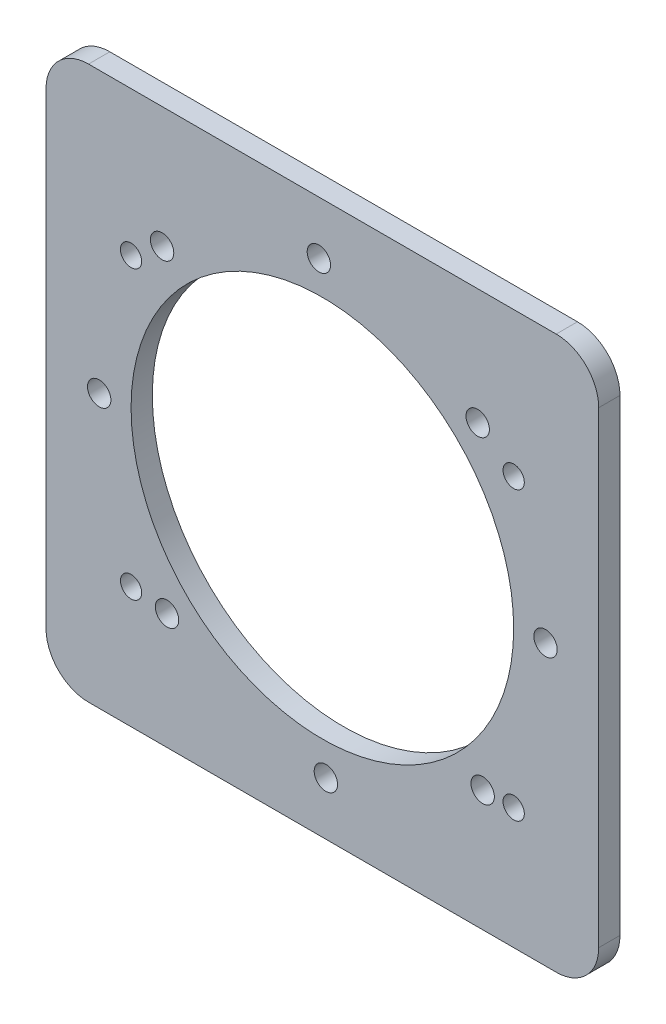
from build123d import *

# Parameters (mm, degrees)
SKETCH_1_W          = 130
SKETCH_1_H          = 130
EXTRUDE_1_DEPTH     = 5
CUT_EXTRUDE_2_REACH = 94.06
SKETCH_5_R          = 45
FILLET_1_R          = 10
CUT_EXTRUDE_3_DEPTH = 10
SKETCH_7_R          = 2.5
CUT_EXTRUDE_4_DEPTH = 93.059763198


with BuildPart() as part:
    # 草图1 → 凸台-拉伸1 (new body)
    with BuildSketch(Plane.XY):
        Rectangle(SKETCH_1_W, SKETCH_1_H)
    extrude(amount=EXTRUDE_1_DEPTH)

    # 草图5 → 切除-拉伸2 (cut, up to next)
    with BuildSketch(Plane(origin=(0, 0, 0), x_dir=(-1, 0, 0), z_dir=(0, 0, -1)), mode=Mode.PRIVATE) as cut_extrude_2_sk1:
        Circle(SKETCH_5_R)
    cut_extrude_2_tool1 = extrude(cut_extrude_2_sk1.sketch, amount=-CUT_EXTRUDE_2_REACH, mode=Mode.PRIVATE) & part.part
    add(cut_extrude_2_tool1.solids().sort_by_distance((0, 0, 0))[0], mode=Mode.SUBTRACT)

    # 圆角1
    fillet_1_edges = [part.edges().sort_by_distance(p)[0] for p in [
        (65, 65, 2.5),
        (65, -65, 2.5),
        (-65, -65, 2.5),
        (-65, 65, 2.5),
    ]]
    fillet(fillet_1_edges, radius=FILLET_1_R)

    # 草图6 → 切除-拉伸3 (cut)
    with BuildSketch(Plane(origin=(0, 0, 0), x_dir=(-1, 0, 0), z_dir=(0, 0, -1))):
        with BuildLine():
            ThreePointArc((39.675797976, 38.449883679), (35.787189387, 38.510902038), (35.726171029, 34.622293449))
            ThreePointArc((35.726171029, 34.622293449), (39.614779618, 34.56127509), (39.675797976, 38.449883679))
        make_face()
        with BuildLine():
            ThreePointArc((54.468351255, 1.090089298), (50.579742665, 1.151107656), (50.518724307, -2.737500933))
            ThreePointArc((50.518724307, -2.737500933), (54.407332896, -2.798519291), (54.468351255, 1.090089298))
        make_face()
        with BuildLine():
            ThreePointArc((38.510902038, -35.787189387), (34.622293449, -35.726171029), (34.56127509, -39.614779618))
            ThreePointArc((34.56127509, -39.614779618), (38.449883679, -39.675797976), (38.510902038, -35.787189387))
        make_face()
        with BuildLine():
            ThreePointArc((1.151107656, -50.579742665), (-2.737500933, -50.518724307), (-2.798519291, -54.407332896))
            ThreePointArc((-2.798519291, -54.407332896), (1.090089298, -54.468351255), (1.151107656, -50.579742665))
        make_face()
        with BuildLine():
            ThreePointArc((-35.726171029, -34.622293449), (-39.614779618, -34.56127509), (-39.675797976, -38.449883679))
            ThreePointArc((-39.675797976, -38.449883679), (-35.787189387, -38.510902038), (-35.726171029, -34.622293449))
        make_face()
        with BuildLine():
            ThreePointArc((-50.518724307, 2.737500933), (-54.407332896, 2.798519291), (-54.468351255, -1.090089298))
            ThreePointArc((-54.468351255, -1.090089298), (-50.579742665, -1.151107656), (-50.518724307, 2.737500933))
        make_face()
        with BuildLine():
            ThreePointArc((-34.56127509, 39.614779618), (-38.449883679, 39.675797976), (-38.510902038, 35.787189387))
            ThreePointArc((-38.510902038, 35.787189387), (-34.622293449, 35.726171029), (-34.56127509, 39.614779618))
        make_face()
        with BuildLine():
            ThreePointArc((2.798519291, 54.407332896), (-1.090089298, 54.468351255), (-1.151107656, 50.579742665))
            ThreePointArc((-1.151107656, 50.579742665), (2.737500933, 50.518724307), (2.798519291, 54.407332896))
        make_face()
    extrude(amount=-CUT_EXTRUDE_3_DEPTH, mode=Mode.SUBTRACT)

    # 草图7 → 切除-拉伸4 (cut, through all)
    with BuildSketch(Plane.XY.offset(5)):
        with Locations((45, 31.034316915)):
            Circle(SKETCH_7_R)
        with Locations((45, -36.465683085)):
            Circle(SKETCH_7_R)
        with Locations((-45, -36.465683085)):
            Circle(SKETCH_7_R)
        with Locations((-45, 31.034316915)):
            Circle(SKETCH_7_R)
    extrude(amount=-CUT_EXTRUDE_4_DEPTH, mode=Mode.SUBTRACT)


solid = part.part
